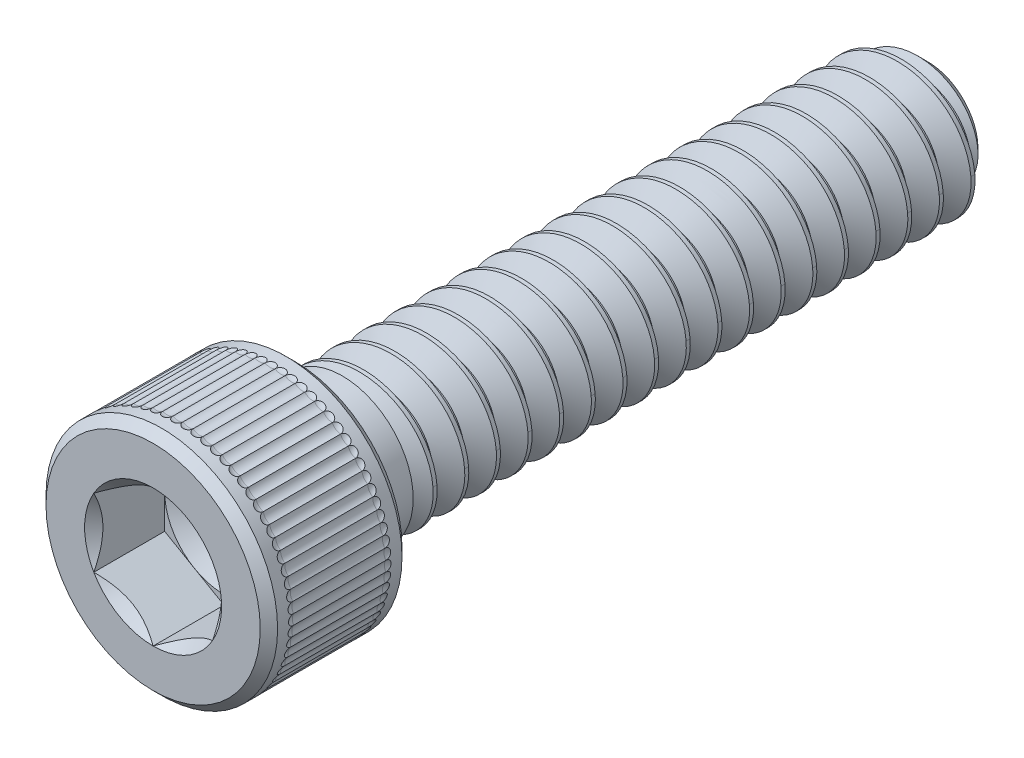
from build123d import *
from build123d.topology import SkipClean

# Parameters (mm, degrees)
CUT_EXTRUDE1_DEPTH = 1.4224
CUT_SWEEP1_PITCH   = 0.635
CIRPATTERN1_COUNT  = 72


with BuildPart() as part:
    # Sketch2 → Revolve1 (revolve)
    with BuildSketch(Plane(origin=(0, 0, 0), x_dir=(0, 0, -1), z_dir=(1, 0, 0)), mode=Mode.PRIVATE) as revolve1_sk:
        with BuildLine():
            Line((-5.1019075, 2.3241), (-4.9276, 2.1497925))
            Line((-4.9276, 2.1497925), (-4.9276, 1.56464))
            ThreePointArc((-4.9276, 1.56464), (-4.885938869, 1.464061131), (-4.78536, 1.4224))
            Line((-4.78536, 1.4224), (7.359955401, 1.4224))
            Line((7.359955401, 1.4224), (7.7724, 1.009955401))
            Line((7.7724, 1.009955401), (7.7724, 0))
            Line((7.7724, 0), (-6.35, 0))
            Line((-6.35, 0), (-6.35, 1.190625))
            Line((-6.35, 1.190625), (-7.7724, 1.190625))
            Line((-7.7724, 1.190625), (-7.7724, 2.1497925))
            Line((-7.7724, 2.1497925), (-7.5980925, 2.3241))
            Line((-7.5980925, 2.3241), (-5.1019075, 2.3241))
        make_face()
    revolve(revolve1_sk.sketch.rotate(Axis((0, 0, 6.35), (0, 0, -1)), 90), axis=Axis((0, 0, 6.35), (0, 0, -1)))

    # Sketch3 → Cut-Extrude1 (cut)
    with BuildSketch(Plane.XY.offset(7.7724)):
        Polygon((0, 1.374815329), (-1.190625, 0.687407664), (-1.190625, -0.687407664), (0, -1.374815329), (1.190625, -0.687407664), (1.190625, 0.687407664), align=None)
    extrude(amount=-CUT_EXTRUDE1_DEPTH, mode=Mode.SUBTRACT)

    # Cut-Extrude2 cone 1 section (through the dimple's axis) → Cut-Extrude2 (revolve, cut)
    with BuildSketch(Plane(origin=(0, 0, 7.7724), x_dir=(0, -1, 0), z_dir=(1, 0, 0))):
        Polygon((0, 0), (1.374815329, 0), (0, 1.374815329), align=None)
    revolve(axis=Axis((0, 0, 7.7724), (0, 0, -1)), mode=Mode.SUBTRACT)

    # Cut-Extrude5 cone 1 section (through the dimple's axis) → Cut-Extrude5 (revolve, cut)
    with BuildSketch(Plane(origin=(0, 0, 6.35), x_dir=(0, -1, 0), z_dir=(1, 0, 0))):
        Polygon((0, 0), (1.190625, 0), (0, 0.687407664), align=None)
    revolve(axis=Axis((0, 0, 6.35), (0, 0, -1)), mode=Mode.SUBTRACT)

    # Cut-Sweep1: arcs per turn and ends read off the stored shape
    # Cut-Sweep1: the profile of Sketch8 screwed along a right-hand helix through 20.625 turns, 6 arcs to a turn; built about Z, then put on its axis
    cut_sweep1_z = Axis((0, 0, 0), (0, 0, 1))
    cut_sweep1_corners = [(1.456770383, 0, 0.01984375), (1.456770383, 0, -0.57546875), (1.009955401, 0, -0.3175), (1.009955401, 0, -0.238125)]
    with BuildLine(mode=Mode.PRIVATE) as cut_sweep1_profile:
        Line(cut_sweep1_corners[0], cut_sweep1_corners[1])
        Line(cut_sweep1_corners[1], cut_sweep1_corners[2])
        Line(cut_sweep1_corners[2], cut_sweep1_corners[3])
        Line(cut_sweep1_corners[3], cut_sweep1_corners[0])
    cut_sweep1_cap = Face(cut_sweep1_profile.wire())
    cut_sweep1_turn_angles = [0, 30, 60, 90, 120, 150, 180, 210, 240, 270, 300, 330, 360]
    cut_sweep1_turn_weights = [1, 0.8660254037844387, 1, 0.8660254037844387, 1, 0.8660254037844387, 1, 0.8660254037844387, 1, 0.8660254037844387, 1, 0.8660254037844387, 1]
    cut_sweep1_turn_rails = [Edge.make_bspline([Vector(p[0], p[1], 0).rotate(cut_sweep1_z, cut_sweep1_turn_angles[k]) / cut_sweep1_turn_weights[k] + Vector(0, 0, p[2] + CUT_SWEEP1_PITCH * cut_sweep1_turn_angles[k] / 360) for k in range(13)], [0, 0, 0, 1, 1, 2, 2, 3, 3, 4, 4, 5, 5, 6, 6, 6], 2, cut_sweep1_turn_weights) for p in cut_sweep1_corners]
    cut_sweep1_turn_sides = [Face.make_surface_from_curves(cut_sweep1_turn_rails[p[0]], cut_sweep1_turn_rails[p[1]]) for p in [(0, 1), (1, 2), (2, 3), (3, 0)]]
    cut_sweep1_last_angles = [7200, 7230, 7260, 7290, 7320, 7350, 7380, 7402.5, 7425]
    cut_sweep1_last_weights = [1, 0.8660254037844387, 1, 0.8660254037844387, 1, 0.8660254037844387, 1, 0.923879532511229, 1]
    cut_sweep1_last_rails = [Edge.make_bspline([Vector(p[0], p[1], 0).rotate(cut_sweep1_z, cut_sweep1_last_angles[k]) / cut_sweep1_last_weights[k] + Vector(0, 0, p[2] + CUT_SWEEP1_PITCH * cut_sweep1_last_angles[k] / 360) for k in range(9)], [0, 0, 0, 1, 1, 2, 2, 3, 3, 4, 4, 4], 2, cut_sweep1_last_weights) for p in cut_sweep1_corners]
    cut_sweep1_last_sides = [Face.make_surface_from_curves(cut_sweep1_last_rails[p[0]], cut_sweep1_last_rails[p[1]]) for p in [(0, 1), (1, 2), (2, 3), (3, 0)]]
    cut_sweep1 = Plane(origin=(0, 0, -7.7724), x_dir=(0, 1, 0), z_dir=(0, 0, 1)) * Solid(Shell([*[p.moved(Location((0, 0, CUT_SWEEP1_PITCH * i))) for i in range(20) for p in cut_sweep1_turn_sides], *cut_sweep1_last_sides, cut_sweep1_cap, cut_sweep1_cap.rotate(cut_sweep1_z, 7425).moved(Location((0, 0, CUT_SWEEP1_PITCH * 7425 / 360)))]))
    add(cut_sweep1, mode=Mode.SUBTRACT)

    # Sketch9 → Revolve2 (revolve)
    with SkipClean():  # the faces are left unmerged after this step: merging them gives an invalid solid
        with BuildSketch(Plane(origin=(0, 0, 0), x_dir=(0, 0, -1), z_dir=(1, 0, 0)), mode=Mode.PRIVATE) as revolve2_sk:
            with BuildLine():
                Line((-5.3641625, 0), (-5.3641625, 1.56464))
                Line((-5.3641625, 1.56464), (-4.9276, 1.56464))
                ThreePointArc((-4.9276, 1.56464), (-4.885938869, 1.464061131), (-4.78536, 1.4224))
                Line((-4.78536, 1.4224), (-3.9751, 1.4224))
                Line((-3.9751, 1.4224), (-3.153876977, 0))
                Line((-3.153876977, 0), (-5.3641625, 0))
            make_face()
        revolve(revolve2_sk.sketch.rotate(Axis((0, 0, 3.153876977), (0, 0, 1)), 270), axis=Axis((0, 0, 3.153876977), (0, 0, 1)))

    # Sketch12 → Cut-Revolve1 (revolve, cut)
    with SkipClean():  # the faces are left unmerged after this step: merging them gives an invalid solid
        with BuildSketch(Plane(origin=(0, 0, 0), x_dir=(0, 0, -1), z_dir=(1, 0, 0))):
            with BuildLine():
                Line((-7.27456, 2.294724403), (-5.42544, 2.294724403))
                ThreePointArc((-5.42544, 2.294724403), (-5.282072943, 2.354108983), (-5.222688364, 2.49747604))
                Line((-5.222688364, 2.49747604), (-7.477311636, 2.49747604))
                ThreePointArc((-7.477311636, 2.49747604), (-7.417927057, 2.354108983), (-7.27456, 2.294724403))
            make_face()
        cut_revolve1 = revolve(axis=Axis((0, 2.49747604, 7.477311636), (0, 0, -1)), mode=Mode.SUBTRACT)

    # CirPattern1: Cut-Revolve1 ×72 about axis
    with SkipClean():  # the faces are left unmerged after this step: merging them gives an invalid solid
        cirpattern1_axis = Axis((0, 0, 0), (0, 0, 1))
        for i in range(1, CIRPATTERN1_COUNT):
            add(cut_revolve1.rotate(cirpattern1_axis, i * 360 / CIRPATTERN1_COUNT), mode=Mode.SUBTRACT)


solid = part.part
